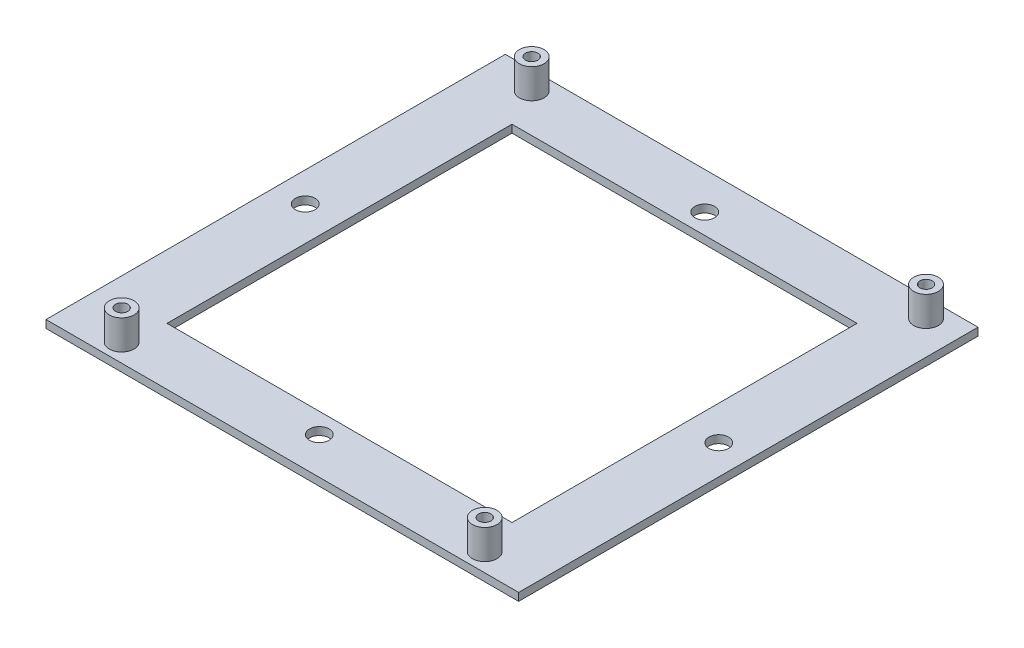
from build123d import *

# Parameters (mm, degrees)
SKETCH1_W                 = 95.9
SKETCH1_H                 = 93.2
SKETCH1_R                 = 2
SKETCH1_W_2               = 70
SKETCH1_H_2               = 70
BOSS_EXTRUDE1_DEPTH       = 1.58
SKETCH2_R                 = 2.5
BOSS_EXTRUDE2_DEPTH       = 6
M3X0_5_TAPPED_HOLE2_D     = 2.5
M3X0_5_TAPPED_HOLE2_DEPTH = 6
M3X0_5_TAPPED_HOLE2_TIP   = 0.751075774


with BuildPart() as part:
    # Sketch1 → Boss-Extrude1 (new body)
    with BuildSketch(Plane(origin=(0, 0, 0), x_dir=(1, 0, 0), z_dir=(0, 1, 0))):
        Rectangle(SKETCH1_W, SKETCH1_H)
        with Locations((0, 39.1)):
            Circle(SKETCH1_R, mode=Mode.SUBTRACT)
        with Locations((41.95, 0)):
            Circle(SKETCH1_R, mode=Mode.SUBTRACT)
        with Locations((0, -39.1)):
            Circle(SKETCH1_R, mode=Mode.SUBTRACT)
        with Locations((-41.95, 0)):
            Circle(SKETCH1_R, mode=Mode.SUBTRACT)
        Rectangle(SKETCH1_W_2, SKETCH1_H_2, mode=Mode.SUBTRACT)
    extrude(amount=BOSS_EXTRUDE1_DEPTH)

    # Sketch2 → Boss-Extrude2 (add)
    with BuildSketch(Plane(origin=(0, 1.58, 0), x_dir=(1, 0, 0), z_dir=(0, 1, 0))):
        with Locations((41.145, 42.8635)):
            Circle(SKETCH2_R)
        with Locations((-38.865, 42.8635)):
            Circle(SKETCH2_R)
        with Locations((-36.325, -42.8665)):
            Circle(SKETCH2_R)
        with Locations((37.335, -42.8665)):
            Circle(SKETCH2_R)
    extrude(amount=BOSS_EXTRUDE2_DEPTH)

    # M3x0.5 Tapped Hole2
    with Locations(Plane(origin=(-38.865, 7.58, -42.8635), x_dir=(0, 0, 1), z_dir=(0, 1, 0))):
        with Locations((0, 0), (85.73, 2.54), (85.73, 76.2), (0, 80.01)):
            Hole(M3X0_5_TAPPED_HOLE2_D / 2, depth=M3X0_5_TAPPED_HOLE2_DEPTH)
            with Locations((0, 0, -(M3X0_5_TAPPED_HOLE2_DEPTH + M3X0_5_TAPPED_HOLE2_TIP / 2))):  # 118° drill point
                Cone(0, M3X0_5_TAPPED_HOLE2_D / 2, M3X0_5_TAPPED_HOLE2_TIP, mode=Mode.SUBTRACT)


solid = part.part
